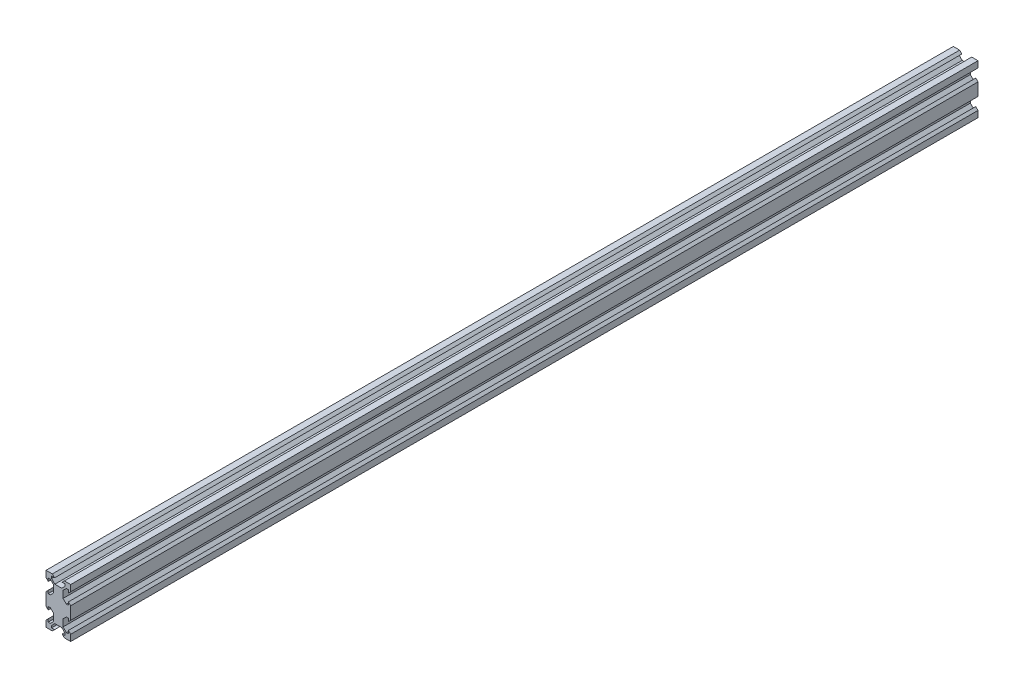
from build123d import *

# Parameters (mm, degrees)
SKETCH1_W           = 20
SKETCH1_H           = 40
BOSS_EXTRUDE1_DEPTH = 735.0125
CUT_EXTRUDE1_DEPTH  = 737.371764231


with BuildPart() as part:
    # Sketch1 → Boss-Extrude1 (new body)
    with BuildSketch(Plane.XY):
        with Locations((10, 20)):
            Rectangle(SKETCH1_W, SKETCH1_H)
    extrude(amount=BOSS_EXTRUDE1_DEPTH)

    # Sketch2 → Cut-Extrude1 (cut, through all)
    with BuildSketch(Plane.XY.offset(735.0125)):
        Polygon((5.12, 40), (6.94, 38.18), (4.5, 38.18), (4.5, 36.475807358), (7.165807358, 33.81), (12.834192642, 33.81), (15.5, 36.475807358), (15.5, 38.18), (13.06, 38.18), (14.88, 40), align=None)
        Polygon((18.18, 35.5), (18.18, 33.06), (20, 34.88), (20, 25.12), (18.18, 26.94), (18.18, 24.5), (16.475807358, 24.5), (13.81, 27.165807358), (13.81, 32.834192642), (16.475807358, 35.5), align=None)
        Polygon((20, 14.88), (18.18, 13.06), (18.18, 15.5), (16.475807358, 15.5), (13.81, 12.834192642), (13.81, 7.165807358), (16.475807358, 4.5), (18.18, 4.5), (18.18, 6.94), (20, 5.12), align=None)
        Polygon((15.5, 1.82), (13.06, 1.82), (14.88, 0), (5.12, 0), (6.94, 1.82), (4.5, 1.82), (4.5, 3.524192642), (7.165807358, 6.19), (12.834192642, 6.19), (15.5, 3.524192642), align=None)
        Polygon((1.82, 4.5), (1.82, 6.94), (0, 5.12), (0, 14.88), (1.82, 13.06), (1.82, 15.5), (3.524192642, 15.5), (6.19, 12.834192642), (6.19, 7.165807358), (3.524192642, 4.5), align=None)
        Polygon((0, 25.12), (1.82, 26.94), (1.82, 24.5), (3.524192642, 24.5), (6.19, 27.165807358), (6.19, 32.834192642), (3.524192642, 35.5), (1.82, 35.5), (1.82, 33.06), (0, 34.88), align=None)
    extrude(amount=-CUT_EXTRUDE1_DEPTH, mode=Mode.SUBTRACT)


solid = part.part
